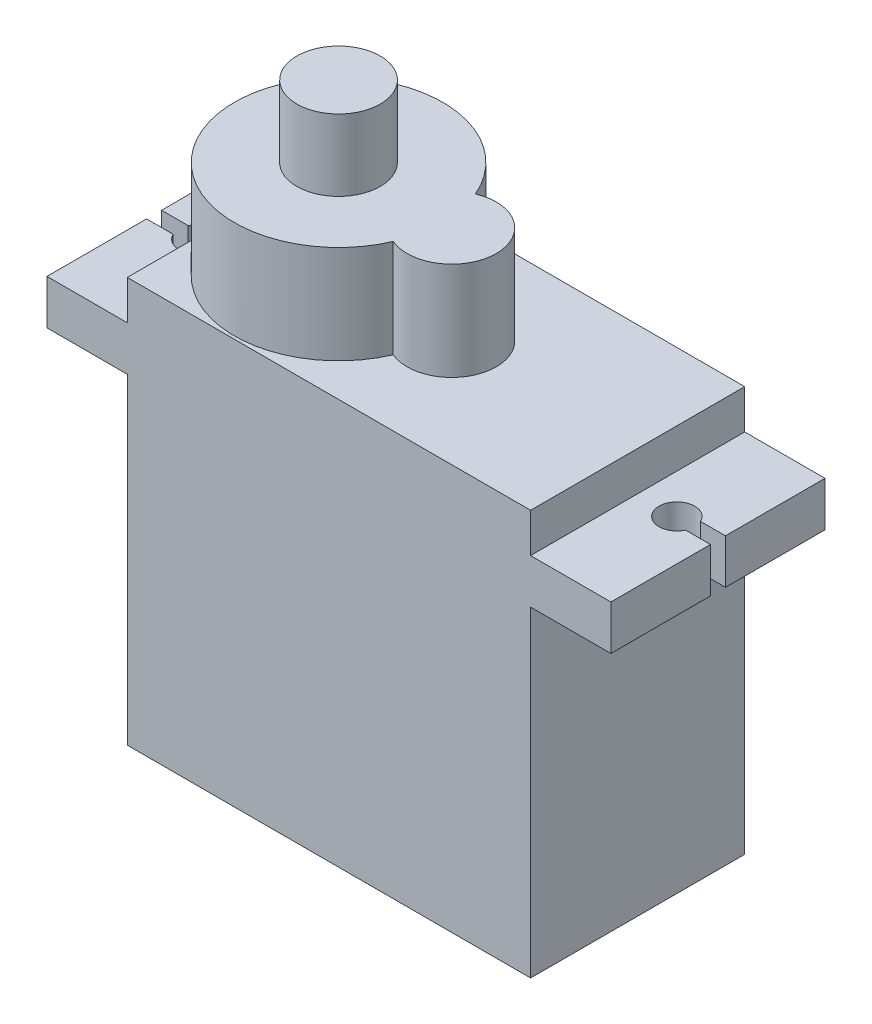
from build123d import *

# Parameters (mm, degrees)
SKETCH1_W            = 22.6
SKETCH1_H            = 12
BOSS_EXTRUDE1_DEPTH  = 22.7
SKETCH4_R            = 5.84
BOSS_EXTRUDE6_DEPTH  = 5.5
SKETCH12_R           = 2.335
BOSS_EXTRUDE7_DEPTH  = 4
BOSS_EXTRUDE8_DEPTH  = 5.5
SKETCH14_W           = 12
SKETCH14_H           = 2.5
BOSS_EXTRUDE10_DEPTH = 4.5
CUT_EXTRUDE3_DEPTH   = 52.05819482
SKETCH16_W           = 12
SKETCH16_H           = 2.5
BOSS_EXTRUDE11_DEPTH = 4.5
CUT_EXTRUDE4_DEPTH   = 56.162931847


with BuildPart() as part:
    # Sketch1 → Boss-Extrude1 (new body)
    with BuildSketch(Plane(origin=(0, 0, 0), x_dir=(1, 0, 0), z_dir=(0, 1, 0))):
        with Locations((-34.895532414, -1.256861806)):
            Rectangle(SKETCH1_W, SKETCH1_H)
    extrude(amount=BOSS_EXTRUDE1_DEPTH)

    # Sketch4 → Boss-Extrude6 (add)
    with BuildSketch(Plane(origin=(0, 22.7, 0), x_dir=(-1, 0, 0), z_dir=(0, 1, 0))):
        with Locations((40.355532414, 1.256861806)):
            Circle(SKETCH4_R)
    extrude(amount=BOSS_EXTRUDE6_DEPTH)

    # Sketch12 → Boss-Extrude7 (add)
    with BuildSketch(Plane(origin=(0, 28.2, 0), x_dir=(-1, 0, 0), z_dir=(0, 1, 0))):
        with Locations((40.355532414, 1.256861806)):
            Circle(SKETCH12_R)
    extrude(amount=BOSS_EXTRUDE7_DEPTH)

    # Sketch13 → Boss-Extrude8 (add)
    with BuildSketch(Plane(origin=(0, 22.7, 0), x_dir=(-1, 0, 0), z_dir=(0, 1, 0))):
        with BuildLine():
            ThreePointArc((34.515532414, 1.256861806), (34.635051968, 2.43232064), (34.988718534, 3.559666352))
            ThreePointArc((34.988718534, 3.559666352), (31.515532414, 1.256861806), (34.988718534, -1.04594274))
            ThreePointArc((34.988718534, -1.04594274), (34.635051968, 0.081402972), (34.515532414, 1.256861806))
        make_face()
    extrude(amount=BOSS_EXTRUDE8_DEPTH)

    # Sketch14 → Boss-Extrude10 (add)
    with BuildSketch(Plane(origin=(-23.595532414, 0, 0), x_dir=(0, 0, -1), z_dir=(1, 0, 0))):
        with Locations((-1.256861806, 19.25)):
            Rectangle(SKETCH14_W, SKETCH14_H)
    extrude(amount=BOSS_EXTRUDE10_DEPTH)

    # Sketch15 → Cut-Extrude3 (cut, through all)
    with BuildSketch(Plane(origin=(0, 20.5, 0), x_dir=(-1, 0, 0), z_dir=(0, 1, 0))):
        with BuildLine():
            Line((19.095532414, 1.676861806), (19.095532414, 0.836861806))
            Line((19.095532414, 0.836861806), (20.488008309, 0.836861806))
            ThreePointArc((20.488008309, 0.836861806), (22.395532414, 1.256861806), (20.488008309, 1.676861806))
            Line((20.488008309, 1.676861806), (19.095532414, 1.676861806))
        make_face()
    extrude(amount=-CUT_EXTRUDE3_DEPTH, mode=Mode.SUBTRACT)

    # Sketch16 → Boss-Extrude11 (add)
    with BuildSketch(Plane.ZY.offset(46.195532414)):
        with Locations((1.256861806, 19.25)):
            Rectangle(SKETCH16_W, SKETCH16_H)
    extrude(amount=BOSS_EXTRUDE11_DEPTH)

    # Sketch17 → Cut-Extrude4 (cut, through all)
    with BuildSketch(Plane(origin=(0, 20.5, 0), x_dir=(-1, 0, 0), z_dir=(0, 1, 0))):
        with BuildLine():
            Line((49.203056518, 0.836861806), (50.695532414, 0.836861806))
            Line((50.695532414, 0.836861806), (50.695532414, 1.676861806))
            Line((50.695532414, 1.676861806), (49.203056518, 1.676861806))
            ThreePointArc((49.203056518, 1.676861806), (47.295532414, 1.256861806), (49.203056518, 0.836861806))
        make_face()
    extrude(amount=-CUT_EXTRUDE4_DEPTH, mode=Mode.SUBTRACT)


solid = part.part
